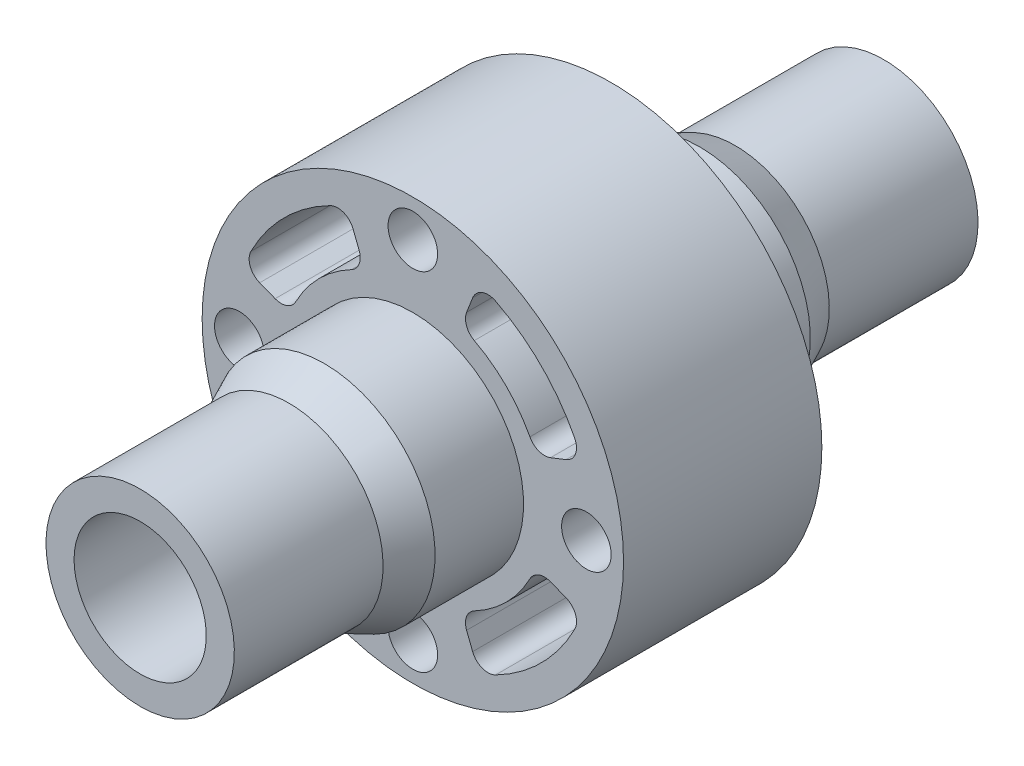
from build123d import *

# Parameters (mm, degrees)
SKETCH_2_R          = 1.5
CUT_EXTRUDE_1_DEPTH = 35.702305399
SKETCH_4_R          = 14
SKETCH_4_R_2        = 12.75
CUT_EXTRUDE_4_DEPTH = 35.702305399
CUT_EXTRUDE_5_DEPTH = 34.724990734
SKETCH_6_R          = 4
CUT_EXTRUDE_6_DEPTH = 49.478087834


with BuildPart() as part:
    # 草图1 → 旋转1 (revolve)
    with BuildSketch(Plane(origin=(0, 0, 0), x_dir=(0, 0, -1), z_dir=(1, 0, 0))):
        Polygon((-22.5, 0), (-22.5, 5.7), (-13.5, 5.7), (-11.355493079, 6.7), (-6, 6.7), (-6, 14), (6, 14), (6, 6.7), (11.355493079, 6.7), (13.5, 5.7), (22.5, 5.7), (22.5, 0), align=None)
    revolve(axis=Axis((0, 0, 22.5), (0, 0, -1)))

    # 草图2 → 切除-拉伸1 (cut, through all)
    with BuildSketch(Plane.XY.offset(6)):
        with Locations((0, 10.5)):
            Circle(SKETCH_2_R)
        with Locations((10.5, 0)):
            Circle(SKETCH_2_R)
        with Locations((0, -10.5)):
            Circle(SKETCH_2_R)
        with Locations((-10.5, 0)):
            Circle(SKETCH_2_R)
    extrude(amount=-CUT_EXTRUDE_1_DEPTH, mode=Mode.SUBTRACT)

    # 草图4 → 切除-拉伸4 (cut, through all)
    with BuildSketch(Plane(origin=(0, 0, -6), x_dir=(-1, 0, 0), z_dir=(0, 0, -1))):
        Circle(SKETCH_4_R)
        Circle(SKETCH_4_R_2, mode=Mode.SUBTRACT)
    extrude(amount=-CUT_EXTRUDE_4_DEPTH, mode=Mode.SUBTRACT)

    # 草图5 → 切除-拉伸5 (cut, through all)
    with BuildSketch(Plane(origin=(0, 0, -6), x_dir=(-1, 0, 0), z_dir=(0, 0, -1))):
        with BuildLine():
            Line((-9.26871571, 3.618136135), (-8.331955809, 3.252462513))
            ThreePointArc((-8.331955809, 3.252462513), (-7.618330669, 3.247249598), (-7.082950618, 3.719114215))
            ThreePointArc((-7.082950618, 3.719114215), (-5.656854249, 5.656854249), (-3.719114215, 7.082950618))
            ThreePointArc((-3.719114215, 7.082950618), (-3.247249598, 7.618330669), (-3.252462513, 8.331955809))
            Line((-3.252462513, 8.331955809), (-3.618136135, 9.26871571))
            ThreePointArc((-3.618136135, 9.26871571), (-4.194460373, 9.839863314), (-5.004644825, 9.795587281))
            ThreePointArc((-5.004644825, 9.795587281), (-7.778174593, 7.778174593), (-9.795587281, 5.004644825))
            ThreePointArc((-9.795587281, 5.004644825), (-9.839863314, 4.194460373), (-9.26871571, 3.618136135))
        make_face()
        with BuildLine():
            Line((3.618136135, 9.26871571), (3.252462513, 8.331955809))
            ThreePointArc((3.252462513, 8.331955809), (3.247249598, 7.618330669), (3.719114215, 7.082950618))
            ThreePointArc((3.719114215, 7.082950618), (5.656854249, 5.656854249), (7.082950618, 3.719114215))
            ThreePointArc((7.082950618, 3.719114215), (7.618330669, 3.247249598), (8.331955809, 3.252462513))
            Line((8.331955809, 3.252462513), (9.26871571, 3.618136135))
            ThreePointArc((9.26871571, 3.618136135), (9.839863314, 4.194460373), (9.795587281, 5.004644825))
            ThreePointArc((9.795587281, 5.004644825), (7.778174593, 7.778174593), (5.004644825, 9.795587281))
            ThreePointArc((5.004644825, 9.795587281), (4.194460373, 9.839863314), (3.618136135, 9.26871571))
        make_face()
        with BuildLine():
            Line((9.26871571, -3.618136135), (8.331955809, -3.252462513))
            ThreePointArc((8.331955809, -3.252462513), (7.618330669, -3.247249598), (7.082950618, -3.719114215))
            ThreePointArc((7.082950618, -3.719114215), (5.656854249, -5.656854249), (3.719114215, -7.082950618))
            ThreePointArc((3.719114215, -7.082950618), (3.247249598, -7.618330669), (3.252462513, -8.331955809))
            Line((3.252462513, -8.331955809), (3.618136135, -9.26871571))
            ThreePointArc((3.618136135, -9.26871571), (4.194460373, -9.839863314), (5.004644825, -9.795587281))
            ThreePointArc((5.004644825, -9.795587281), (7.778174593, -7.778174593), (9.795587281, -5.004644825))
            ThreePointArc((9.795587281, -5.004644825), (9.839863314, -4.194460373), (9.26871571, -3.618136135))
        make_face()
        with BuildLine():
            Line((-3.618136135, -9.26871571), (-3.252462513, -8.331955809))
            ThreePointArc((-3.252462513, -8.331955809), (-3.247249598, -7.618330669), (-3.719114215, -7.082950618))
            ThreePointArc((-3.719114215, -7.082950618), (-5.656854249, -5.656854249), (-7.082950618, -3.719114215))
            ThreePointArc((-7.082950618, -3.719114215), (-7.618330669, -3.247249598), (-8.331955809, -3.252462513))
            Line((-8.331955809, -3.252462513), (-9.26871571, -3.618136135))
            ThreePointArc((-9.26871571, -3.618136135), (-9.839863314, -4.194460373), (-9.795587281, -5.004644825))
            ThreePointArc((-9.795587281, -5.004644825), (-7.778174593, -7.778174593), (-5.004644825, -9.795587281))
            ThreePointArc((-5.004644825, -9.795587281), (-4.194460373, -9.839863314), (-3.618136135, -9.26871571))
        make_face()
    extrude(amount=-CUT_EXTRUDE_5_DEPTH, mode=Mode.SUBTRACT)

    # 草图6 → 切除-拉伸6 (cut, through all)
    with BuildSketch(Plane(origin=(0, 0, -22.5), x_dir=(-1, 0, 0), z_dir=(0, 0, -1))):
        Circle(SKETCH_6_R)
    extrude(amount=-CUT_EXTRUDE_6_DEPTH, mode=Mode.SUBTRACT)


solid = part.part
